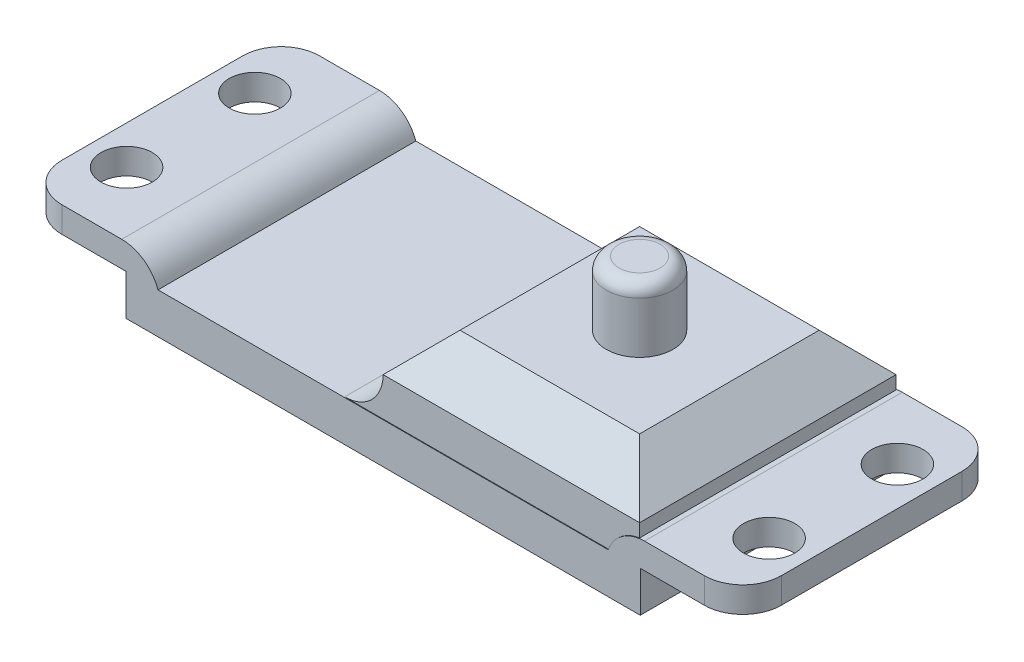
from build123d import *

# Parameters (mm, degrees)
SKETCH1_W            = 40.1
SKETCH1_H            = 20.1
BOSS_EXTRUDE1_DEPTH  = 3.175
SKETCH2_W            = 2.5
SKETCH2_H            = 20.1
BOSS_EXTRUDE2_DEPTH  = 2
SKETCH3_W            = 20.1
SKETCH3_H            = 2
BOSS_EXTRUDE3_DEPTH  = 8
SKETCH4_R            = 2
CUT_EXTRUDE1_DEPTH   = 30.964739695
FILLET1_R            = 3
FILLET2_R            = 3
FILLET1_OF_MIRROR2_R = 3
FILLET2_OF_MIRROR2_R = 3
SKETCH7_W            = 20
SKETCH7_H            = 20
BOSS_EXTRUDE5_DEPTH  = 6
SKETCH5_R            = 2.6
BOSS_EXTRUDE4_DEPTH  = 5
FILLET4_R            = 3
CHAMFER1_SIZE        = 3
FILLET5_R            = 1


# Some blends are built 0.0001 mm under size
with BuildPart() as part:
    # Sketch1 → Boss-Extrude1 (new body)
    with BuildSketch(Plane(origin=(0, 0, 0), x_dir=(1, 0, 0), z_dir=(0, 1, 0))):
        Rectangle(SKETCH1_W, SKETCH1_H)
    extrude(amount=BOSS_EXTRUDE1_DEPTH)

    # Sketch2 → Boss-Extrude2 (add)
    with BuildSketch(Plane(origin=(0, 3.175, 0), x_dir=(1, 0, 0), z_dir=(0, 1, 0))):
        with Locations((18.8, 0)):
            Rectangle(SKETCH2_W, SKETCH2_H)
    boss_extrude2 = extrude(amount=BOSS_EXTRUDE2_DEPTH)

    # Sketch3 → Boss-Extrude3 (add)
    with BuildSketch(Plane(origin=(20.05, 0, 0), x_dir=(0, 0, -1), z_dir=(1, 0, 0))):
        with Locations((0, 4.175)):
            Rectangle(SKETCH3_W, SKETCH3_H)
    boss_extrude3 = extrude(amount=BOSS_EXTRUDE3_DEPTH)

    # Sketch4 → Cut-Extrude1 (cut, symmetric)
    with BuildSketch(Plane.XZ.offset(-3.175)):
        with Locations(Location((25.05, 5, 0), (0, 0, 270))):
            Circle(SKETCH4_R)
        with Locations(Location((25.05, -5, 0), (0, 0, 270))):
            Circle(SKETCH4_R)
    cut_extrude1 = extrude(amount=CUT_EXTRUDE1_DEPTH, both=True, mode=Mode.SUBTRACT)

    # Fillet1
    # the kernel refuses this fillet: 3 mm, written as the material it takes off along each edge
    with BuildSketch(Plane(origin=(17.55, 5.175, -17.121067812), x_dir=(0, -1, 0), z_dir=(0, 0, 1))) as fillet1_piece_1:
        with BuildLine():
            CenterArc((3, 2.828427125), FILLET1_R, 180, 70.528779366)
            Line((0, 2.828427125), (-0.06, 2.828427125))
            Line((-0.06, 2.828427125), (-0.06, 0))
            Line((-0.06, 0), (0, -0.06))
            ThreePointArc((0, -0.06), (1, -0.06), (1.98, -0.056568542))
            Line((1.98, -0.056568542), (2, 0))
        make_face()
    extrude(amount=34.242135624, mode=Mode.SUBTRACT)

    # Fillet2
    fillet2_edges = [part.edges().sort_by_distance(p)[0] for p in [
        (28.05, 4.175, 10.05),
        (28.05, 4.175, -10.05),
    ]]
    fillet(fillet2_edges, radius=FILLET2_R)

    # Mirror2: Boss-Extrude2, Boss-Extrude3, Cut-Extrude1 across plane
    add(boss_extrude2.mirror(Plane(origin=(0, 0, 0), x_dir=(0, 0, 1), z_dir=(1, 0, 0))))
    add(boss_extrude3.mirror(Plane(origin=(0, 0, 0), x_dir=(0, 0, 1), z_dir=(1, 0, 0))))
    add(cut_extrude1.mirror(Plane(origin=(0, 0, 0), x_dir=(0, 0, 1), z_dir=(1, 0, 0))), mode=Mode.SUBTRACT)

    # Fillet1 of Mirror2
    # the kernel refuses this fillet: 3 mm, written as the material it takes off along each edge
    with BuildSketch(Plane(origin=(-17.55, 5.175, -17.121067812), x_dir=(-1, 0, 0), z_dir=(0, 0, 1))) as fillet1_of_mirror2_piece_1:
        with BuildLine():
            CenterArc((2.828427125, 3), FILLET1_OF_MIRROR2_R, 199.471220634, 70.528779366)
            Line((0, 2), (-0.056568542, 1.98))
            ThreePointArc((-0.056568542, 1.98), (-0.06, 1), (-0.06, 0))
            Line((-0.06, 0), (0, -0.06))
            Line((0, -0.06), (2.828427125, -0.06))
            Line((2.828427125, -0.06), (2.828427125, 0))
        make_face()
    extrude(amount=34.242135624, mode=Mode.SUBTRACT)

    # Fillet2 of Mirror2
    fillet2_of_mirror2_edges = [part.edges().sort_by_distance(p)[0] for p in [
        (-28.05, 4.175, 10.05),
        (-28.05, 4.175, -10.05),
    ]]
    fillet(fillet2_of_mirror2_edges, radius=FILLET2_OF_MIRROR2_R)

    # Sketch7 → Boss-Extrude5 (add)
    with BuildSketch(Plane(origin=(0, 3.175, 0), x_dir=(1, 0, 0), z_dir=(0, 1, 0))):
        with Locations((9.95, 0)):
            Rectangle(SKETCH7_W, SKETCH7_H)
    extrude(amount=BOSS_EXTRUDE5_DEPTH)

    # Sketch5 → Boss-Extrude4 (add)
    with BuildSketch(Plane(origin=(0, 9.175, 0), x_dir=(1, 0, 0), z_dir=(0, 1, 0))):
        with Locations(Location((9.95, 0, 0), (0, 0, 270))):
            Circle(SKETCH5_R)
    extrude(amount=BOSS_EXTRUDE4_DEPTH)

    # Fillet4
    fillet4_edges = [part.edges().sort_by_distance(p)[0] for p in [
        (-0.05, 3.175, 0),
    ]]
    fillet(fillet4_edges, radius=FILLET4_R)

    # Chamfer1
    chamfer1_edges = [part.edges().sort_by_distance(p)[0] for p in [
        (19.95, 9.175, 0),
        (9.95, 9.175, -10),
        (-0.05, 9.175, 0),
        (9.95, 9.175, 10),
    ]]
    chamfer(chamfer1_edges, length=CHAMFER1_SIZE - 0.0001)  # a hair under: the kernel refuses the full size

    # Fillet5
    fillet5_edges = [part.edges().sort_by_distance(p)[0] for p in [
        (9.95, 14.175, -2.6),
    ]]
    fillet(fillet5_edges, radius=FILLET5_R)


solid = part.part
